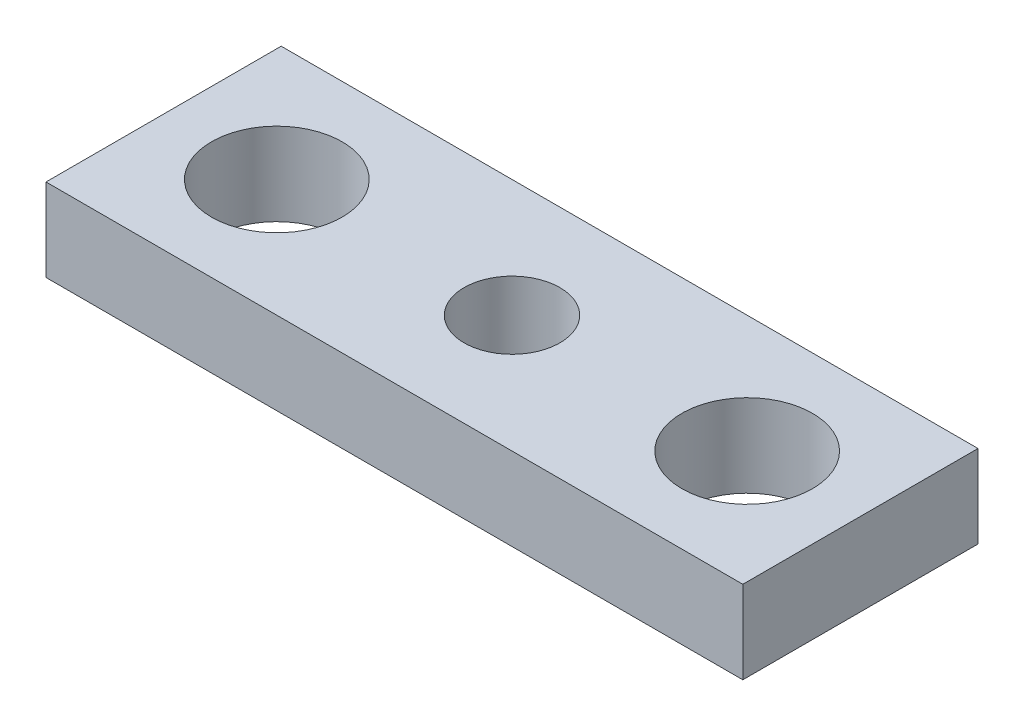
from build123d import *

# Parameters (mm, degrees)
SKETCH_1_W          = 80
SKETCH_1_H          = 27
EXTRUDE_1_DEPTH     = 9.5
SKETCH_3_R          = 7.5
CUT_EXTRUDE_1_DEPTH = 44.272393047
SKETCH_10_R         = 5.5
CUT_EXTRUDE_2_DEPTH = 44.272393047


with BuildPart() as part:
    # 草图1 → 凸台-拉伸1 (new body)
    with BuildSketch(Plane(origin=(0, 0, 0), x_dir=(1, 0, 0), z_dir=(0, 1, 0))):
        Rectangle(SKETCH_1_W, SKETCH_1_H)
    extrude(amount=EXTRUDE_1_DEPTH)

    # 草图3 → 切除-拉伸1 (cut, through all)
    with BuildSketch(Plane(origin=(0, 9.5, 0), x_dir=(1, 0, 0), z_dir=(0, 1, 0))):
        with Locations((-27, 0)):
            Circle(SKETCH_3_R)
        with Locations((27, 0)):
            Circle(SKETCH_3_R)
    extrude(amount=-CUT_EXTRUDE_1_DEPTH, mode=Mode.SUBTRACT)

    # 草图10 → 切除-拉伸2 (cut, through all)
    with BuildSketch(Plane.XZ):
        Circle(SKETCH_10_R)
    extrude(amount=-CUT_EXTRUDE_2_DEPTH, mode=Mode.SUBTRACT)


solid = part.part
